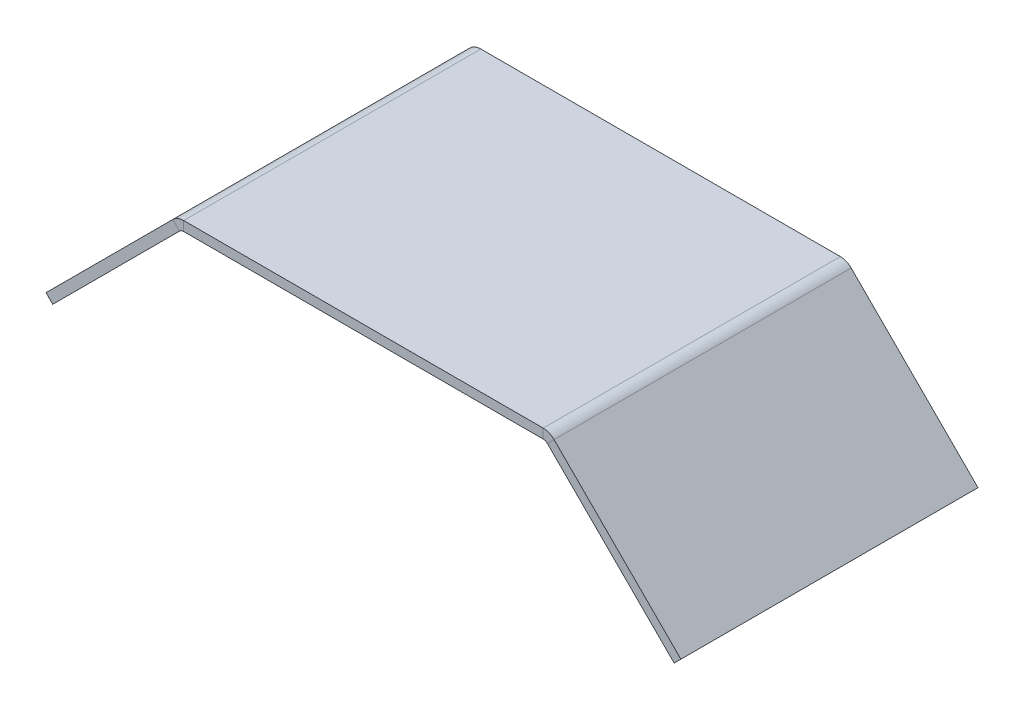
from build123d import *

# Parameters (mm, degrees)
SKETCH7_W               = 61.468
SKETCH7_H               = 50.8
BASE_FLANGE2_DEPTH      = 1.6256
EDGE_FLANGE1_DEPTH      = 50.8
EDGE_FLANGE1_BEND_DEPTH = 50.8


# Sheet-metal steps are written as plain solids
with BuildPart() as part:
    # Sketch7 → Base-Flange2 (new body)
    with BuildSketch(Plane(origin=(0, 0, 0), x_dir=(1, 0, 0), z_dir=(0, 1, 0))):
        Rectangle(SKETCH7_W, SKETCH7_H)
    extrude(amount=-BASE_FLANGE2_DEPTH)

    # Edge-Flange1 section (across the edge) → Edge-Flange1 (add)
    with BuildSketch(Plane(origin=(-31.148213562, -1.6256, 25.4), x_dir=(0.7071067811865438, -0.7071067811865512, 0), z_dir=(0, 0, -1))):
        with BuildLine():
            Line((-1.6256, 0.414213562), (-1.6256, 31.076654433))
            Line((-1.6256, 31.076654433), (0, 31.076654433))
            Line((0, 31.076654433), (0, 0.414213562))
            ThreePointArc((0, 0.414213562), (0.076120467, 0.03153013), (0.292893219, -0.292893219))
            Line((0.292893219, -0.292893219), (-0.856579565, -1.442366002))
            ThreePointArc((-0.856579565, -1.442366002), (-1.425738101, -0.590560058), (-1.6256, 0.414213562))
        make_face()
    extrude(amount=EDGE_FLANGE1_DEPTH)

    # Edge-Flange1 section 2 (across the edge) → Edge-Flange1 bend (add)
    with BuildSketch(Plane(origin=(31.148213562, -1.6256, -25.4), x_dir=(-0.7071067811865438, -0.7071067811865512, 0), z_dir=(0, 0, 1))):
        with BuildLine():
            Line((-1.6256, 0.414213562), (-1.6256, 31.076654433))
            Line((-1.6256, 31.076654433), (0, 31.076654433))
            Line((0, 31.076654433), (0, 0.414213562))
            ThreePointArc((0, 0.414213562), (0.076120467, 0.03153013), (0.292893219, -0.292893219))
            Line((0.292893219, -0.292893219), (-0.856579565, -1.442366002))
            ThreePointArc((-0.856579565, -1.442366002), (-1.425738101, -0.590560058), (-1.6256, 0.414213562))
        make_face()
    extrude(amount=EDGE_FLANGE1_BEND_DEPTH)


solid = part.part
